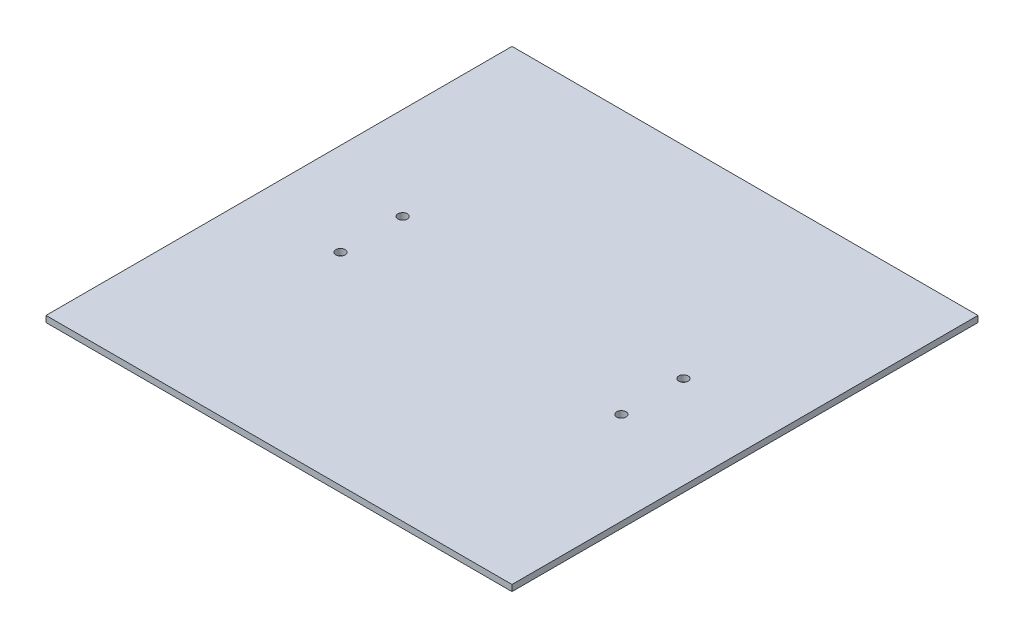
from build123d import *

# Parameters (mm, degrees)
SKETCH1_W           = 150
SKETCH1_H           = 150
SKETCH1_R           = 1.5
BOSS_EXTRUDE1_DEPTH = 2


with BuildPart() as part:
    # Sketch1 → Boss-Extrude1 (new body)
    with BuildSketch(Plane(origin=(0, 0, 0), x_dir=(1, 0, 0), z_dir=(0, 1, 0))):
        with Locations((75, 75)):
            Rectangle(SKETCH1_W, SKETCH1_H)
        with Locations((29.8, 85)):
            Circle(SKETCH1_R, mode=Mode.SUBTRACT)
        with Locations((29.8, 65)):
            Circle(SKETCH1_R, mode=Mode.SUBTRACT)
        with Locations((120.2, 65)):
            Circle(SKETCH1_R, mode=Mode.SUBTRACT)
        with Locations((120.2, 85)):
            Circle(SKETCH1_R, mode=Mode.SUBTRACT)
    extrude(amount=BOSS_EXTRUDE1_DEPTH)


solid = part.part
